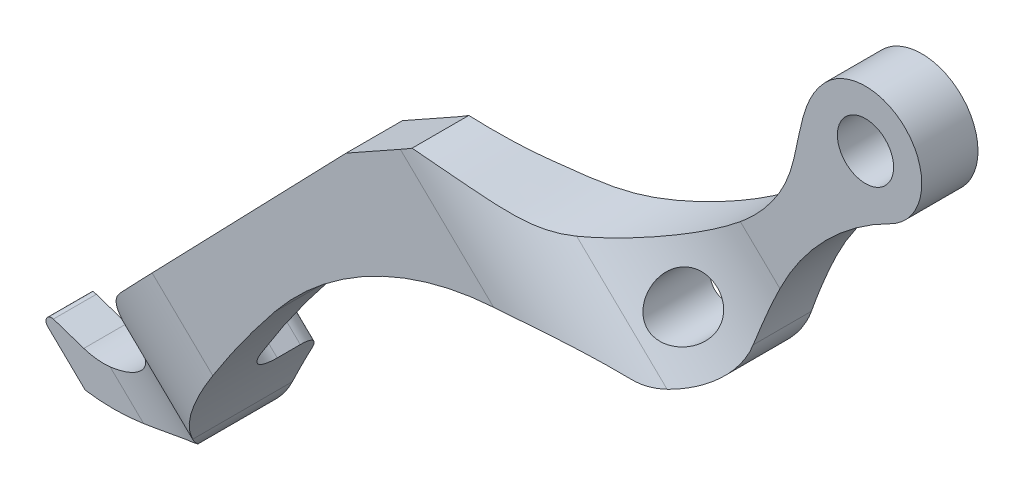
from build123d import *

# Parameters (mm, degrees)
SKETCH_1_R               = 2.5
EXTRUDE_1_DEPTH          = 6
SKETCH_2_OUTSIDE_W       = 116.224
SKETCH_2_OUTSIDE_H       = 89.061
CUT_EXTRUDE_1_DEPTH      = 12
CUT_EXTRUDE_2_DEPTH      = 10
CUT_EXTRUDE_2_DEPTH_BACK = 58.99683528
SKETCH_3_OUTSIDE_W       = 33.874
SKETCH_3_OUTSIDE_H       = 119.124
FILLET_1_R               = 0.5


with BuildPart() as part:
    # 草圖1 → 填料-伸長1 (new, symmetric)
    with BuildSketch(Plane.XY):
        with BuildLine():
            Line((33.210571119, 22.487406669), (9.212656684, 9.024071248))
            Line((9.212656684, 9.024071248), (9.212656684, 13.217540535))
            Line((9.212656684, 13.217540535), (-51.018500429, 13.217540535))
            Line((-51.018500429, 13.217540535), (-51.018500429, -41.386180002))
            Line((-51.018500429, -41.386180002), (9.212656684, -41.386180002))
            Line((9.212656684, -41.386180002), (9.212656684, -5))
            Line((9.212656684, -5), (21.5, -5))
            ThreePointArc((21.5, -5), (23.692257033, -4.493774483), (25.440603486, -3.07760364))
            Line((25.440603486, -3.07760364), (39.59758023, 15.049172396))
            ThreePointArc((39.59758023, 15.049172396), (39.450390654, 21.384077206), (33.210571119, 22.487406669))
        make_face()
        with Locations((21.5, 0)):
            Circle(SKETCH_1_R, mode=Mode.SUBTRACT)
        with Locations((35.656976744, 18.126776036)):
            Circle(SKETCH_1_R, mode=Mode.SUBTRACT)
    extrude(amount=EXTRUDE_1_DEPTH, both=True)

    # 草圖2 outside → 除料-伸長1 (cut)
    with BuildSketch(Plane.XY.offset(6)):
        with Locations((-5.181, -9.1295)):
            Rectangle(SKETCH_2_OUTSIDE_W, SKETCH_2_OUTSIDE_H)
        with BuildLine():
            Line((-3.504662874, 1.889387135), (-24.499095951, -19.837093245))
            ThreePointArc((-24.499095951, -19.837093245), (-25.530846828, -21.28330144), (-26.093887373, -22.968238639))
            Line((-26.093887373, -22.968238639), (-26.940110928, -27.785073774))
            ThreePointArc((-26.940110928, -27.785073774), (-29.508767127, -31.506192899), (-34.004940633, -31.984884889))
            Line((-34.004940633, -31.984884889), (-38.806738202, -30.371166034))
            Line((-38.806738202, -30.371166034), (-33.875603228, -35.136152419))
            ThreePointArc((-33.875603228, -35.136152419), (-28.5650672, -35.094081272), (-23.520676583, -33.433453021))
            ThreePointArc((-23.520676583, -33.433453021), (-21.623015625, -32.029319154), (-20.278640263, -30.088864592))
            ThreePointArc((-20.278640263, -30.088864592), (-15.559314436, -21.479893225), (-9.851228903, -13.492141112))
            ThreePointArc((-9.851228903, -13.492141112), (3.673898096, -4.470950273), (19.929199503, -4.746850092))
            ThreePointArc((19.929199503, -4.746850092), (23.974199209, -4.344920975), (26.383894798, -1.071247685))
            ThreePointArc((26.383894798, -1.071247685), (30.458421446, 7.595163953), (37.879524863, 13.647905658))
            ThreePointArc((37.879524863, 13.647905658), (39.697047859, 21.072590929), (32.072223107, 21.612395258))
            add(Edge.make_bspline(
                [(32.072223107, 21.612395258), (29.619553058, 19.089968877), (30.529442098, 9.384107467), (14.497116464, 0.221014353), (7.895302384, 4.290965143), (2.303499892, 5.147888773)],
                knots=[0, 0, 0, 0, 0.241565864, 0.691252681, 1, 1, 1, 1], degree=3))
            Line((2.303499892, 5.147888773), (-3.504662874, 1.889387135))
        make_face(mode=Mode.SUBTRACT)
    extrude(amount=-CUT_EXTRUDE_1_DEPTH, mode=Mode.SUBTRACT)

    # 草圖3 outside → 除料-伸長2 (cut, two sides: drawn at the far end of the back side and taken through both)
    with BuildSketch(Plane(origin=(-2.756507166, 2.663630014, 0), x_dir=(0, 0, 1), z_dir=(-0.7191178918168458, 0.6948880900324134, 0)).offset(-CUT_EXTRUDE_2_DEPTH_BACK)):
        with Locations((0, -3.742)):
            Rectangle(SKETCH_3_OUTSIDE_W, SKETCH_3_OUTSIDE_H)
        with BuildLine():
            Line((-6.187691288, -50.234611396), (-6.018499381, -32.113761289))
            ThreePointArc((-6.018499381, -32.113761289), (-5.426182761, -30.711634106), (-4.018586552, -30.132434202))
            Line((-4.018586552, -30.132434202), (-1.968123233, -30.132434202))
            ThreePointArc((-1.968123233, -30.132434202), (0.130656832, -29.263091034), (1, -27.164310969))
            Line((1, -27.164310969), (1, 4.214817456))
            ThreePointArc((1, 4.214817456), (0.578987205, 6.455061571), (-0.626602337, 8.38961561))
            ThreePointArc((-0.626602337, 8.38961561), (-4.609205755, 14.780315976), (-6, 22.180847883))
            Line((-6, 22.180847883), (-6, 42.812897435))
            Line((-6, 42.812897435), (-1, 42.812897435))
            Line((-1, 42.812897435), (-1, 22.180847883))
            ThreePointArc((-1, 22.180847883), (0.049659461, 16.595522548), (3.055407703, 11.772336713))
            ThreePointArc((3.055407703, 11.772336713), (5.237852421, 8.270268144), (6, 4.214817456))
            Line((6, 4.214817456), (6, -25.885224287))
            ThreePointArc((6, -25.885224287), (4.929184182, -31.828600934), (1.85140464, -37.024526797))
            ThreePointArc((1.85140464, -37.024526797), (-0.403254217, -40.83085539), (-1.187691288, -45.184736692))
            Line((-1.187691288, -45.184736692), (-1.187691288, -50.234611396))
            Line((-1.187691288, -50.234611396), (-6.187691288, -50.234611396))
        make_face(mode=Mode.SUBTRACT)
    extrude(amount=CUT_EXTRUDE_2_DEPTH + CUT_EXTRUDE_2_DEPTH_BACK, mode=Mode.SUBTRACT)

    # 導角1
    # the kernel refuses this chamfer: 1.5, 1 mm, written as the material it takes off along each edge
    with BuildSketch(Plane(origin=(-26.093887373, -22.968238639, -6), x_dir=(-0.282693705610689, 0.04966374508326484, 0.9579236823632671), z_dir=(-0.1730305243432829, -0.9849164622674802, 0))) as chamfer_1_piece_1:
        with BuildLine():
            Line((1.304503805, 0), (-0.777114665, -1.723908552))
            Line((-0.777114665, -1.723908552), (-0.992647493, -1.65932837))
            ThreePointArc((-0.992647493, -1.65932837), (-0.484534059, -0.833196734), (-0.215532829, 0.064580181))
            Line((-0.215532829, 0.064580181), (0.064580181, 0.215532829))
            ThreePointArc((0.064580181, 0.215532829), (0.663098125, 0.036198675), (1.369083986, 0.215532829))
            Line((1.369083986, 0.215532829), (1.304503805, 0))
        make_face()
    extrude(amount=4.890602726, mode=Mode.SUBTRACT)
    with BuildSketch(Plane(origin=(-34.004940633, -31.984884889, -6), x_dir=(0.0914334019577149, 0.27207012289855914, 0.9579236823632674), z_dir=(-0.9479034644759905, 0.31855772166816915, 0))) as chamfer_1_piece_2:
        with BuildLine():
            Line((1.304503805, 0), (-0.777114665, -1.723908552))
            Line((-0.777114665, -1.723908552), (-0.992647493, -1.65932837))
            ThreePointArc((-0.992647493, -1.65932837), (-0.484534059, -0.833196734), (-0.215532829, 0.064580181))
            Line((-0.215532829, 0.064580181), (0.064580181, 0.215532829))
            ThreePointArc((0.064580181, 0.215532829), (0.663098125, 0.036198675), (1.369083986, 0.215532829))
            Line((1.369083986, 0.215532829), (1.304503805, 0))
        make_face()
    extrude(amount=9.793128388, mode=Mode.SUBTRACT)
    with BuildSketch(Plane(origin=(-20.1843886, -24.006421785, -6), x_dir=(-0.1096964588169662, 0.9939651336556115, 0), z_dir=(0.9939651336556115, 0.1096964588169662, 0))) as chamfer_1_piece_3:
        with BuildLine():
            Line((6.374422632, 1.249615088), (4.125577368, -0.249615088))
            Line((4.125577368, -0.249615088), (4.125577368, -0.474615088))
            ThreePointArc((4.125577368, -0.474615088), (5.062788684, -0.225), (6, -0.225))
            Line((6, -0.225), (6.225, 0))
            ThreePointArc((6.225, 0), (6.225, 0.624807544), (6.599422632, 1.249615088))
            Line((6.599422632, 1.249615088), (6.374422632, 1.249615088))
        make_face()
    revolve(axis=Axis((-20.1843886, -24.006421785, -6), (0, 0, 1)), revolution_arc=73.738114823, mode=Mode.SUBTRACT)
    with BuildSketch(Plane(origin=(-32.278357873, -26.847248381, -6), x_dir=(0.9849164622674801, -0.17303052434328284, 0), z_dir=(0.17303052434328284, 0.9849164622674801, 0))) as chamfer_1_piece_4:
        with BuildLine():
            Line((5.045577083, -1.249615088), (7.294422348, 0.249615088))
            Line((7.294422348, 0.249615088), (7.294422348, 0.474615088))
            ThreePointArc((7.294422348, 0.474615088), (6.357211031, 0.225), (5.419999715, 0.225))
            Line((5.419999715, 0.225), (5.194999715, 0))
            ThreePointArc((5.194999715, 0), (5.194999715, -0.624807544), (4.820577083, -1.249615088))
            Line((4.820577083, -1.249615088), (5.045577083, -1.249615088))
        make_face()
    revolve(axis=Axis((-32.278357873, -26.847248381, -6), (0, 0, -1)), revolution_arc=98.611657286, mode=Mode.SUBTRACT)

    # 圓角1
    fillet_1_edges = [part.edges().sort_by_distance(p)[0] for p in [
        (-38.806738202, -30.371166034, -3.093845644),
    ]]
    fillet(fillet_1_edges, radius=FILLET_1_R)


solid = part.part
